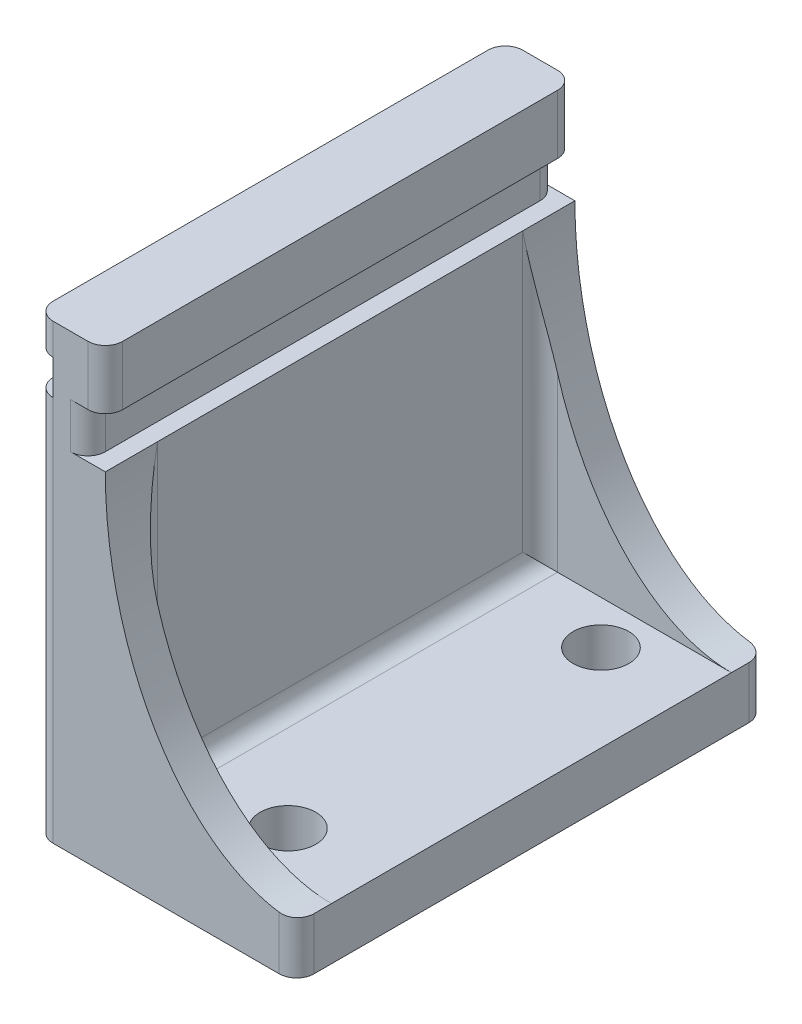
from build123d import *

# Parameters (mm, degrees)
SKETCH1_W               = 15
SKETCH1_H               = 27
SKETCH1_R               = 1.6
BOSS_EXTRUDE1_DEPTH     = 3
SKETCH2_W               = 4
SKETCH2_H               = 27
BOSS_EXTRUDE2_DEPTH     = 23
SKETCH3_W               = 27
SKETCH3_H               = 2
CUT_EXTRUDE1_DEPTH      = 1
SKETCH4_W               = 27
SKETCH4_H               = 2.6
CUT_EXTRUDE2_DEPTH      = 1
SKETCH5_W               = 11
SKETCH5_H               = 2
BOSS_EXTRUDE3_DEPTH     = 17
CUT_EXTRUDE3_DEPTH      = 37.84087404
CUT_EXTRUDE3_DEPTH_BACK = 37.84087404
SKETCH7_RX              = 17
SKETCH7_RY              = 11
FILLET2_R               = 1
FILLET3_START           = -11.5
FILLET3_DEPTH           = 23
FILLET3_START_2         = 2
FILLET3_2_DEPTH         = 18
FILLET3_3_DEPTH         = 23


with BuildPart() as part:
    # Sketch1 → Boss-Extrude1 (new body)
    with BuildSketch(Plane(origin=(0, 0, 0), x_dir=(1, 0, 0), z_dir=(0, 1, 0))):
        Rectangle(SKETCH1_W, SKETCH1_H)
        with Locations(Location((2.5, 9, 0), (0, 0, 270))):
            Circle(SKETCH1_R, mode=Mode.SUBTRACT)
        with Locations(Location((2.5, -9, 0), (0, 0, 90))):
            Circle(SKETCH1_R, mode=Mode.SUBTRACT)
    extrude(amount=BOSS_EXTRUDE1_DEPTH)

    # Sketch2 → Boss-Extrude2 (add)
    with BuildSketch(Plane(origin=(0, 3, 0), x_dir=(1, 0, 0), z_dir=(0, 1, 0))):
        with Locations((-5.5, 0)):
            Rectangle(SKETCH2_W, SKETCH2_H)
    extrude(amount=BOSS_EXTRUDE2_DEPTH)

    # Sketch3 → Cut-Extrude1 (cut)
    with BuildSketch(Plane.ZY.offset(7.5)):
        with Locations((0, 23.2)):
            Rectangle(SKETCH3_W, SKETCH3_H)
    extrude(amount=-CUT_EXTRUDE1_DEPTH, mode=Mode.SUBTRACT)

    # Sketch4 → Cut-Extrude2 (cut)
    with BuildSketch(Plane(origin=(-3.5, 0, 0), x_dir=(0, 0, -1), z_dir=(1, 0, 0))):
        with Locations((0, 21.3)):
            Rectangle(SKETCH4_W, SKETCH4_H)
    extrude(amount=-CUT_EXTRUDE2_DEPTH, mode=Mode.SUBTRACT)

    # Sketch5 → Boss-Extrude3 (add)
    with BuildSketch(Plane(origin=(0, 3, 0), x_dir=(1, 0, 0), z_dir=(0, 1, 0))):
        with Locations((2, 12.5)):
            Rectangle(SKETCH5_W, SKETCH5_H)
        with Locations((2, -12.5)):
            Rectangle(SKETCH5_W, SKETCH5_H)
    extrude(amount=BOSS_EXTRUDE3_DEPTH)

    # Sketch7 → Cut-Extrude3 (cut, two sides: drawn at the far end of the back side and taken through both)
    with BuildSketch(Plane.XY.offset(-11.5).offset(-CUT_EXTRUDE3_DEPTH_BACK)):
        with Locations(Location((7.5, 20), (0, 0, 90))):
            Ellipse(SKETCH7_RX, SKETCH7_RY)
    extrude(amount=CUT_EXTRUDE3_DEPTH + CUT_EXTRUDE3_DEPTH_BACK, mode=Mode.SUBTRACT)

    # Fillet2
    fillet2_edges = [part.edges().sort_by_distance(p)[0] for p in [
        (-7.5, 25.1, 13.5),
        (-7.5, 11.1, 13.5),
        (7.5, 1.5, 13.5),
        (-4.5, 21.3, 13.5),
        (-3.5, 24.3, 13.5),
        (-7.5, 25.1, -13.5),
        (-7.5, 11.1, -13.5),
        (7.5, 1.5, -13.5),
        (-4.5, 21.3, -13.5),
        (-3.5, 24.3, -13.5),
    ]]
    fillet(fillet2_edges, radius=FILLET2_R - 0.0001)  # a hair under: the kernel refuses the full size

    # Fillet3: read off the stored shape, not the designer's step
    # Fillet3 outline → Fillet3 (add)
    with BuildSketch(Plane.XY.offset(FILLET3_START)):
        with BuildLine():
            ThreePointArc((-2.5, 3), (-3.207106781, 3.292893219), (-3.5, 4))
            Line((-3.5, 4), (-3.5, 3))
            Line((-3.5, 3), (-2.5, 3))
        make_face()
    extrude(amount=FILLET3_DEPTH)

    # Fillet3 2 outline → Fillet3 2 (add)
    with BuildSketch(Plane(origin=(0, 0, 0), x_dir=(1, 0, 0), z_dir=(0, 1, 0)).offset(FILLET3_START_2)):
        with BuildLine():
            Line((-3.5, 11.5), (-3.5, 10.5))
            ThreePointArc((-3.5, 10.5), (-3.207106781, 11.207106781), (-2.5, 11.5))
            Line((-2.5, 11.5), (-3.5, 11.5))
        make_face()
        with BuildLine():
            ThreePointArc((-2.5, -11.5), (-3.207106781, -11.207106781), (-3.5, -10.5))
            Line((-3.5, -10.5), (-3.5, -11.5))
            Line((-3.5, -11.5), (-2.5, -11.5))
        make_face()
    extrude(amount=FILLET3_2_DEPTH)

    # Fillet3 3 outline → Fillet3 3 (cut)
    with BuildSketch(Plane.XY.offset(FILLET3_START)):
        with BuildLine():
            Line((-2.5, 20), (-3.5, 20))
            add(Edge.make_bspline(
                [(-3.5, 20), (-3.5, 16.290295866), (-2.5, 12.917837562)],
                knots=[4.71238898, 4.71238898, 4.71238898, 5.142088647, 5.142088647, 5.142088647], degree=2, weights=[1, 0.977008421, 1]))
            Line((-2.5, 12.917837562), (-2.5, 20))
        make_face()
    extrude(amount=FILLET3_3_DEPTH, mode=Mode.SUBTRACT)


solid = part.part
